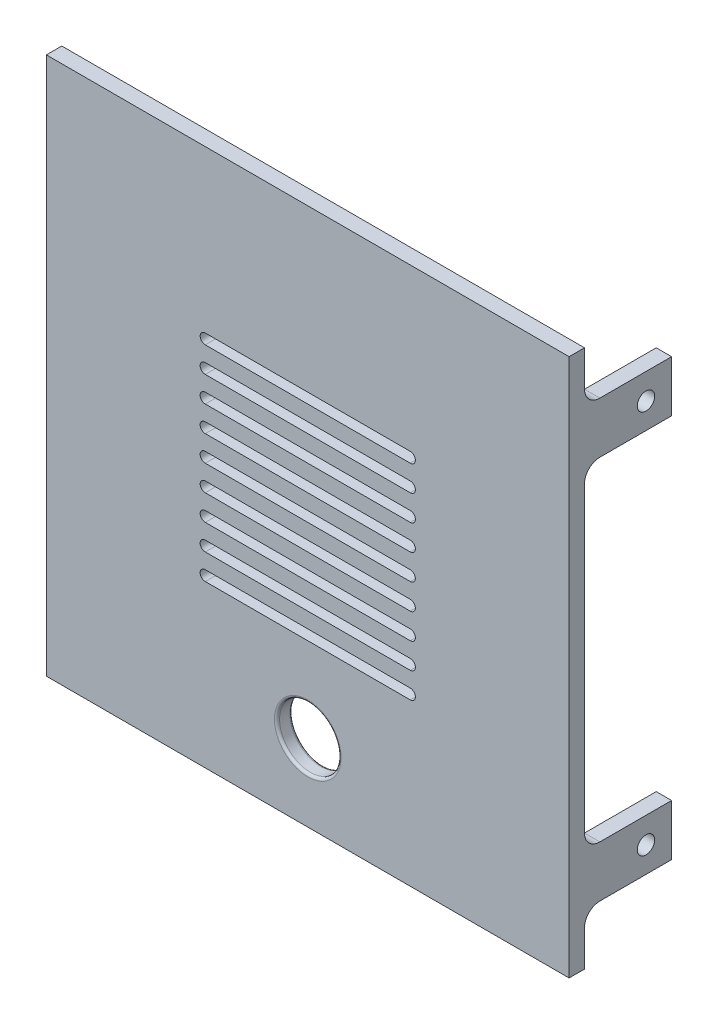
from build123d import *

# Parameters (mm, degrees)
SKETCH1_W                = 102
SKETCH1_H                = 105
BOSS_EXTRUDE1_DEPTH      = 1.5
SKETCH2_W                = 3
SKETCH2_H                = 10
BOSS_EXTRUDE2_DEPTH      = 23
FILLET1_R                = 2
M3_CLEARANCE_HOLE1_D     = 3.4
SKETCH6_W                = 3
SKETCH6_H                = 10
BOSS_EXTRUDE3_DEPTH      = 17
M3_CLEARANCE_HOLE2_D     = 3.4
M3_CLEARANCE_HOLE2_DEPTH = 3
CUT_EXTRUDE1_DEPTH       = 10
SKETCH10_R               = 6
CUT_EXTRUDE2_DEPTH       = 10
FILLET2_R                = 3
FILLET3_R                = 0.5


with BuildPart() as part:
    # Sketch1 → Boss-Extrude1 (new, symmetric)
    with BuildSketch(Plane.XY):
        Rectangle(SKETCH1_W, SKETCH1_H)
    extrude(amount=BOSS_EXTRUDE1_DEPTH, both=True)

    # Sketch2 → Boss-Extrude2 (add)
    with BuildSketch(Plane(origin=(0, 0, -1.5), x_dir=(-1, 0, 0), z_dir=(0, 0, -1))):
        with Locations((42.57, -34.23)):
            Rectangle(SKETCH2_W, SKETCH2_H)
    extrude(amount=BOSS_EXTRUDE2_DEPTH)

    # Fillet1
    fillet1_edges = [part.edges().sort_by_distance(p)[0] for p in [
        (-44.07, -34.23, -1.5),
        (-41.07, -34.23, -1.5),
    ]]
    fillet(fillet1_edges, radius=FILLET1_R)

    # M3 Clearance Hole1 (through all)
    with Locations(Plane.ZY.offset(44.07)):
        with Locations((-20.5, -34.23)):
            Hole(M3_CLEARANCE_HOLE1_D / 2)

    # Sketch6 → Boss-Extrude3 (add)
    with BuildSketch(Plane(origin=(0, 0, -1.5), x_dir=(-1, 0, 0), z_dir=(0, 0, -1))):
        with Locations((-49.5, -37.5)):
            Rectangle(SKETCH6_W, SKETCH6_H)
    boss_extrude3 = extrude(amount=BOSS_EXTRUDE3_DEPTH)

    # M3 Clearance Hole2
    with Locations(Plane(origin=(51, 0, 0), x_dir=(0, 0, -1), z_dir=(1, 0, 0))):
        with Locations((13.5, -37.5)):
            m3_clearance_hole2 = Hole(M3_CLEARANCE_HOLE2_D / 2, depth=M3_CLEARANCE_HOLE2_DEPTH)

    # Sketch9 → Cut-Extrude1 (cut)
    with BuildSketch(Plane.XY.offset(1.5)):
        with BuildLine():
            Line((-20, 6), (20, 6))
            ThreePointArc((20, 6), (21, 5), (20, 4))
            Line((20, 4), (-20, 4))
            ThreePointArc((-20, 4), (-21, 5), (-20, 6))
        make_face()
        with BuildLine():
            Line((-20, 1), (20, 1))
            ThreePointArc((20, 1), (21, 0), (20, -1))
            Line((20, -1), (-20, -1))
            ThreePointArc((-20, -1), (-21, 0), (-20, 1))
        make_face()
        with BuildLine():
            Line((-20, -4), (20, -4))
            ThreePointArc((20, -4), (21, -5), (20, -6))
            Line((20, -6), (-20, -6))
            ThreePointArc((-20, -6), (-21, -5), (-20, -4))
        make_face()
        with BuildLine():
            Line((-20, 11), (20, 11))
            ThreePointArc((20, 11), (21, 10), (20, 9))
            Line((20, 9), (-20, 9))
            ThreePointArc((-20, 9), (-21, 10), (-20, 11))
        make_face()
        with BuildLine():
            Line((-20, -9), (20, -9))
            ThreePointArc((20, -9), (21, -10), (20, -11))
            Line((20, -11), (-20, -11))
            ThreePointArc((-20, -11), (-21, -10), (-20, -9))
        make_face()
        with BuildLine():
            Line((-20, 16), (20, 16))
            ThreePointArc((20, 16), (21, 15), (20, 14))
            Line((20, 14), (-20, 14))
            ThreePointArc((-20, 14), (-21, 15), (-20, 16))
        make_face()
        with BuildLine():
            Line((-20, 21), (20, 21))
            ThreePointArc((20, 21), (21, 20), (20, 19))
            Line((20, 19), (-20, 19))
            ThreePointArc((-20, 19), (-21, 20), (-20, 21))
        make_face()
        with BuildLine():
            Line((-20, -14), (20, -14))
            ThreePointArc((20, -14), (21, -15), (20, -16))
            Line((20, -16), (-20, -16))
            ThreePointArc((-20, -16), (-21, -15), (-20, -14))
        make_face()
        with BuildLine():
            Line((-20, -19), (20, -19))
            ThreePointArc((20, -19), (21, -20), (20, -21))
            Line((20, -21), (-20, -21))
            ThreePointArc((-20, -21), (-21, -20), (-20, -19))
        make_face()
    extrude(amount=-CUT_EXTRUDE1_DEPTH, mode=Mode.SUBTRACT)

    # Sketch10 → Cut-Extrude2 (cut)
    with BuildSketch(Plane(origin=(0, 0, -1.5), x_dir=(-1, 0, 0), z_dir=(0, 0, -1))):
        with Locations((0, -37.5)):
            Circle(SKETCH10_R)
    extrude(amount=-CUT_EXTRUDE2_DEPTH, mode=Mode.SUBTRACT)

    # Mirror1: Boss-Extrude3, M3 Clearance Hole2 across plane
    add(boss_extrude3.mirror(Plane.ZX))
    add(m3_clearance_hole2.mirror(Plane.ZX), mode=Mode.SUBTRACT)

    # Fillet2
    fillet2_edges = [part.edges().sort_by_distance(p)[0] for p in [
        (49.5, -32.5, -1.5),
    ]]
    fillet(fillet2_edges, radius=FILLET2_R)
    fillet2_2_edges = [part.edges().sort_by_distance(p)[0] for p in [
        (48, -37.5, -1.5),
    ]]
    fillet(fillet2_2_edges, radius=FILLET2_R)
    fillet2_3_edges = [part.edges().sort_by_distance(p)[0] for p in [
        (49.5, -42.5, -1.5),
    ]]
    fillet(fillet2_3_edges, radius=FILLET2_R)
    fillet2_4_edges = [part.edges().sort_by_distance(p)[0] for p in [
        (49.5, 42.5, -1.5),
    ]]
    fillet(fillet2_4_edges, radius=FILLET2_R)
    fillet2_5_edges = [part.edges().sort_by_distance(p)[0] for p in [
        (48, 37.5, -1.5),
    ]]
    fillet(fillet2_5_edges, radius=FILLET2_R - 0.0001)  # a hair under: the kernel refuses the full size
    fillet2_6_edges = [part.edges().sort_by_distance(p)[0] for p in [
        (49.5, 32.5, -1.5),
    ]]
    fillet(fillet2_6_edges, radius=FILLET2_R - 0.0001)  # a hair under: the kernel refuses the full size
    fillet2_7_edges = [part.edges().sort_by_distance(p)[0] for p in [
        (-42.57, -29.23, -1.5),
    ]]
    fillet(fillet2_7_edges, radius=FILLET2_R)
    fillet2_8_edges = [part.edges().sort_by_distance(p)[0] for p in [
        (-42.57, -39.23, -1.5),
    ]]
    fillet(fillet2_8_edges, radius=FILLET2_R)

    # Fillet3
    fillet3_edges = [part.edges().sort_by_distance(p)[0] for p in [
        (6, -37.5, 1.5),
        (6, -37.5, -1.5),
    ]]
    fillet(fillet3_edges, radius=FILLET3_R)


solid = part.part
